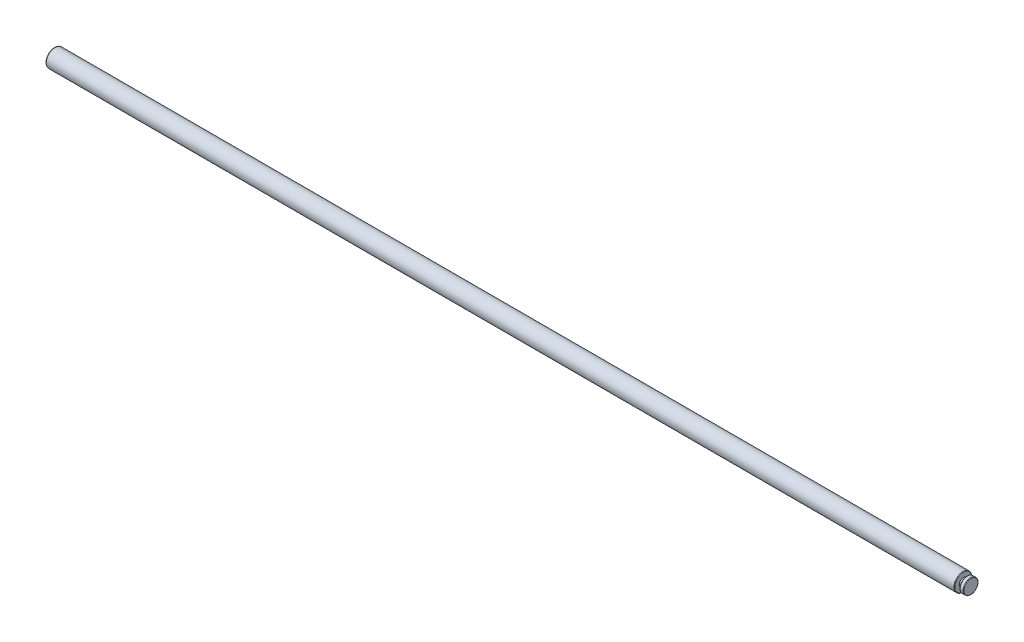
from build123d import *

# Parameters (mm, degrees)
FILLET1_R = 0.2
FILLET2_R = 0.2
FILLET3_R = 0.4


with BuildPart() as part:
    # Sketch1 → Revolve1 (revolve)
    with BuildSketch(Plane.XY):
        Polygon((-180, 0), (180, 0), (180, 2.9), (178.5, 2.9), (178.5, 1.5), (177, 1.5), (177, 3.5), (-180, 3.5), align=None)
    revolve(axis=Axis((-180, 0, 0), (1, 0, 0)))

    # Fillet1
    fillet1_edges = [part.edges().sort_by_distance(p)[0] for p in [
        (177, -3.5, 0),
    ]]
    fillet(fillet1_edges, radius=FILLET1_R)

    # Fillet2
    fillet2_edges = [part.edges().sort_by_distance(p)[0] for p in [
        (178.5, -2.9, 0),
        (180, -2.9, 0),
    ]]
    fillet(fillet2_edges, radius=FILLET2_R)

    # Fillet3
    fillet3_edges = [part.edges().sort_by_distance(p)[0] for p in [
        (-180, -3.5, 0),
    ]]
    fillet(fillet3_edges, radius=FILLET3_R)


solid = part.part
